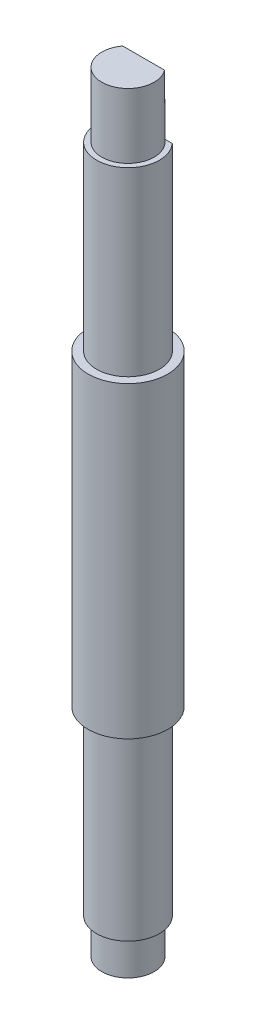
from build123d import *

# Parameters (mm, degrees)
CUT_EXTRUDE_3_REACH = 38.898
CUT_EXTRUDE_START   = -10.35
CUT_EXTRUDE_5_DEPTH = 10.35
CUT_EXTRUDE_7_DEPTH = 1.4


with BuildPart() as part:
    # 草图1 → 旋转2 (revolve)
    with BuildSketch(Plane.XY, mode=Mode.PRIVATE) as revolve_2_sk:
        Polygon((1.25, 5.955283348), (0, 5.955283348), (0, -30.844716652), (1.25, -30.844716652), (1.25, -29.144716652), (1.5, -29.144716652), (1.5, -20.494716652), (1.9, -20.494716652), (1.9, -5.794716652), (1.5, -5.794716652), (1.5, 2.855283348), (1.25, 2.855283348), align=None)
    revolve(revolve_2_sk.sketch.rotate(Axis((0, 5.955283348, 0), (0, -1, 0)), 180), axis=Axis((0, 5.955283348, 0), (0, -1, 0)))

    # 切除-拉伸3: up to this face of the body (flat: up to its plane)
    cut_extrude_3_end = Plane(part.part.faces().sort_by_distance((1.846259885, -5.794716652, 0))[0])
    # 草图5 → 切除-拉伸3 (cut, up to the picked face)
    with BuildSketch(Plane(origin=(0, 5.955283348, 0), x_dir=(1, 0, 0), z_dir=(0, 1, 0)), mode=Mode.PRIVATE) as cut_extrude_3_sk1:
        with BuildLine():
            Line((-1.118033989, 1), (1.118033989, 1))
            ThreePointArc((1.118033989, 1), (0, 1.5), (-1.118033989, 1))
        make_face()
    cut_extrude_3_tool1 = split(extrude(cut_extrude_3_sk1.sketch, amount=-CUT_EXTRUDE_3_REACH, mode=Mode.PRIVATE), bisect_by=cut_extrude_3_end, keep=Keep.BOTH, mode=Mode.PRIVATE)
    add(cut_extrude_3_tool1.solids().sort_by(Axis((0, 5.955283, -1.203164), (0, -1, 0)))[0], mode=Mode.SUBTRACT)

    # 草图7 → 切除-拉伸5 (cut)
    with BuildSketch(Plane.XZ.offset(30.844716652).offset(CUT_EXTRUDE_START)):
        with BuildLine():
            Line((1.118033989, -1), (-1.118033989, -1))
            ThreePointArc((-1.118033989, -1), (0, -1.5), (1.118033989, -1))
        make_face()
    extrude(amount=CUT_EXTRUDE_5_DEPTH, mode=Mode.SUBTRACT)

    # 草图10 → 切除-拉伸7 (cut)
    with BuildSketch(Plane(origin=(0, 5.955283348, 0), x_dir=(1, 0, 0), z_dir=(0, 1, 0))):
        with BuildLine():
            Line((-1, 0.75), (1, 0.75))
            ThreePointArc((1, 0.75), (0, 1.25), (-1, 0.75))
        make_face()
    extrude(amount=-CUT_EXTRUDE_7_DEPTH, mode=Mode.SUBTRACT)


solid = part.part
